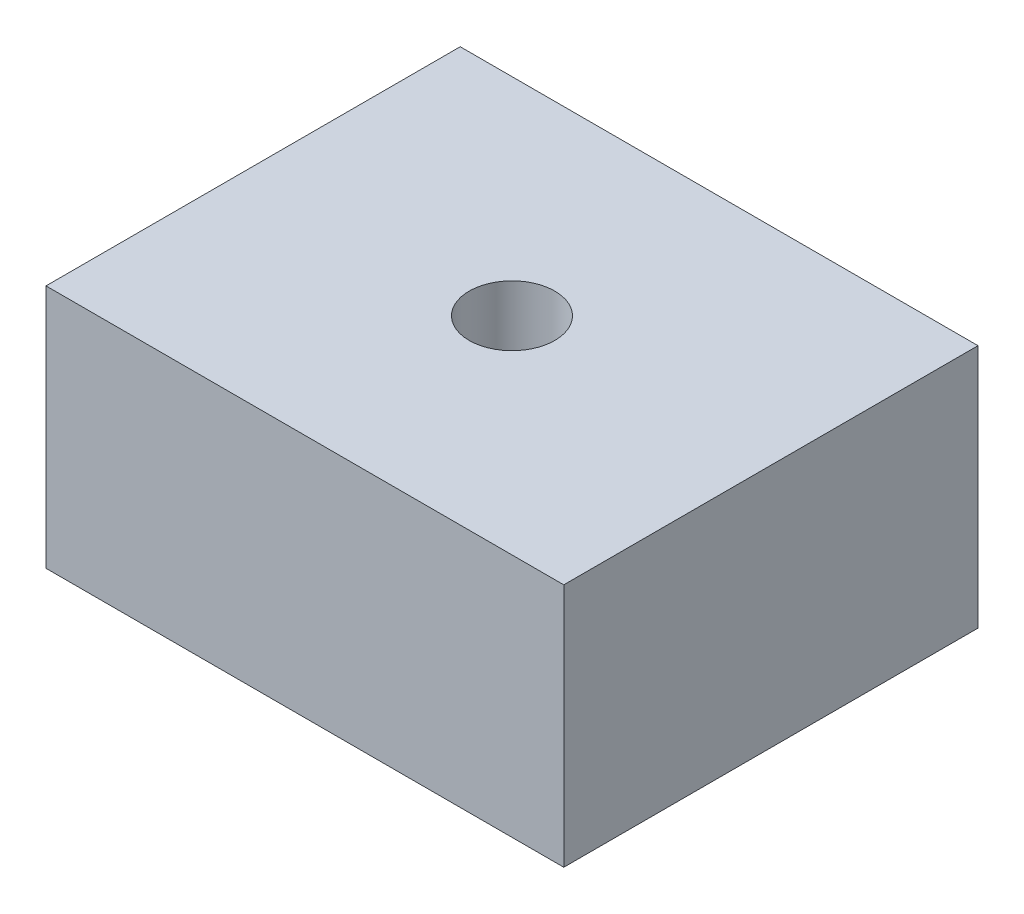
from build123d import *

# Parameters (mm, degrees)
SKETCH1_W           = 63.5
SKETCH1_H           = 50.8
SKETCH1_R           = 5.25
BOSS_EXTRUDE1_DEPTH = 30


with BuildPart() as part:
    # Sketch1 → Boss-Extrude1 (new body)
    with BuildSketch(Plane(origin=(0, 0, 0), x_dir=(1, 0, 0), z_dir=(0, 1, 0))):
        Rectangle(SKETCH1_W, SKETCH1_H)
        Circle(SKETCH1_R, mode=Mode.SUBTRACT)
    extrude(amount=BOSS_EXTRUDE1_DEPTH)


solid = part.part
